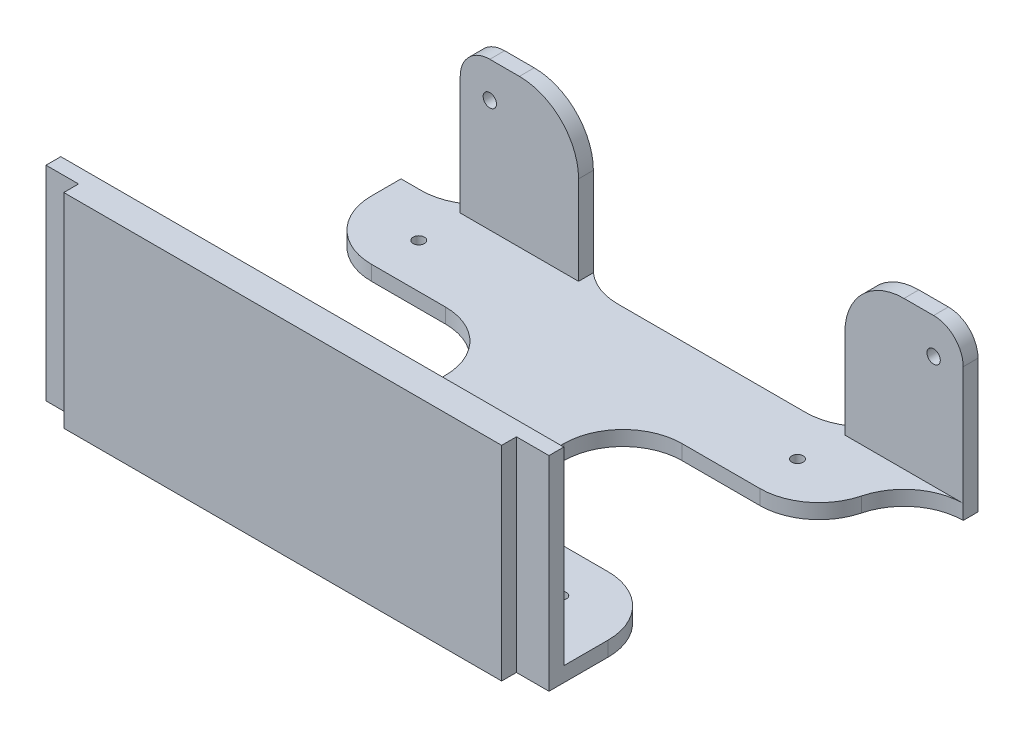
from build123d import *

# Parameters (mm, degrees)
SKETCH1_R           = 1.9
BOSS_EXTRUDE1_DEPTH = 5
SKETCH1_4_W         = 148
SKETCH1_4_H         = 5
BOSS_EXTRUDE3_DEPTH = 69
SKETCH1_5_W         = 150
SKETCH1_5_H         = 5
SKETCH1_5_W_2       = 20
BOSS_EXTRUDE4_DEPTH = 55
SKETCH2_R           = 2.25
CUT_EXTRUDE1_DEPTH  = 60
FILLET1_R           = 20
FILLET2_R           = 10
SKETCH4_W           = 90
SKETCH4_H           = 5
CUT_EXTRUDE2_DEPTH  = 55
FILLET3_R           = 20


# Some blends are built 0.0001 mm under size
with BuildPart() as part:
    # Sketch1 → Boss-Extrude1 (new body)
    with BuildSketch(Plane(origin=(0, 0, 0), x_dir=(1, 0, 0), z_dir=(0, 1, 0))):
        Polygon((-85, -22.5), (-85, -57.5), (85, -57.5), (85, -22.5), (20, -22.5), (20, 27.5), (85, 27.5), (85, 57.5), (-65, 57.5), (-85, 57.5), (-85, 27.5), (-20, 27.5), (-20, -22.5), align=None)
        with Locations(Location((-64, -37.5, 0), (0, 0, 270))):
            Circle(SKETCH1_R, mode=Mode.SUBTRACT)
        with Locations(Location((64, -37.5, 0), (0, 0, 270))):
            Circle(SKETCH1_R, mode=Mode.SUBTRACT)
        with Locations(Location((-64, 42.5, 0), (0, 0, 270))):
            Circle(SKETCH1_R, mode=Mode.SUBTRACT)
        with Locations(Location((64, 42.5, 0), (0, 0, 270))):
            Circle(SKETCH1_R, mode=Mode.SUBTRACT)
    extrude(amount=BOSS_EXTRUDE1_DEPTH)

    # Sketch1<4> → Boss-Extrude3 (add)
    with BuildSketch(Plane(origin=(0, 0, 0), x_dir=(1, 0, 0), z_dir=(0, 1, 0))):
        with Locations((0, -65)):
            Rectangle(SKETCH1_4_W, SKETCH1_4_H)
        Polygon((85, -57.5), (-85, -57.5), (-85, -62.5), (-74, -62.5), (74, -62.5), (85, -62.5), align=None)
    extrude(amount=BOSS_EXTRUDE3_DEPTH)

    # Sketch1<5> → Boss-Extrude4 (add)
    with BuildSketch(Plane(origin=(0, 0, 0), x_dir=(1, 0, 0), z_dir=(0, 1, 0))):
        with Locations((10, 60)):
            Rectangle(SKETCH1_5_W, SKETCH1_5_H)
        with Locations((95, 60)):
            Rectangle(SKETCH1_5_W_2, SKETCH1_5_H)
    extrude(amount=BOSS_EXTRUDE4_DEPTH)

    # Sketch2 → Cut-Extrude1 (cut)
    with BuildSketch(Plane(origin=(0, 0, -62.5), x_dir=(-1, 0, 0), z_dir=(0, 0, -1))):
        with Locations((-95, 43)):
            Circle(SKETCH2_R)
        with Locations((55, 43)):
            Circle(SKETCH2_R)
    extrude(amount=-CUT_EXTRUDE1_DEPTH, mode=Mode.SUBTRACT)

    # Fillet1
    fillet1_edges = [part.edges().sort_by_distance(p)[0] for p in [
        (85, 2.5, -57.5),
    ]]
    fillet(fillet1_edges, radius=FILLET1_R - 0.0001)  # a hair under: the kernel refuses the full size

    # Fillet2
    fillet2_edges = [part.edges().sort_by_distance(p)[0] for p in [
        (-65, 55, -60),
        (105, 55, -60),
    ]]
    fillet(fillet2_edges, radius=FILLET2_R)

    # Sketch4 → Cut-Extrude2 (cut)
    with BuildSketch(Plane(origin=(0, 55, 0), x_dir=(1, 0, 0), z_dir=(0, 1, 0))):
        with Locations((20, 60)):
            Rectangle(SKETCH4_W, SKETCH4_H)
    extrude(amount=-CUT_EXTRUDE2_DEPTH, mode=Mode.SUBTRACT)

    # Fillet3
    # the kernel refuses this fillet: 20 mm, written as the material it adds along each edge
    with BuildSketch(Plane(origin=(65, 5, -57.5), x_dir=(-1, 0, 0), z_dir=(0, -1, 0))) as fillet3_piece_1:
        with BuildLine():
            CenterArc((13.228756555, 20), FILLET3_R, 228.590377891, 41.409622109)
            Line((0, 5), (0, 0))
            Line((0, 0), (13.228756555, 0))
        make_face()
    extrude(amount=5)
    with BuildSketch(Plane(origin=(-25, 5, -57.5), x_dir=(0, 0, -1), z_dir=(0, -1, 0)), Plane(origin=(-65, 0, -57.5), x_dir=(0, 0, -1), z_dir=(0, 1, 0))) as fillet3_piece_2:
        with BuildLine():
            CenterArc((20, 13.228756555), FILLET3_R, 180, 41.409622109)
            Line((0, 13.228756555), (0, 0))
            Line((0, 0), (5, 0))
        make_face()
    extrude(amount=5)
    with BuildSketch(Plane(origin=(-20, 0, 22.5), x_dir=(-1, 0, 0), z_dir=(0, 1, 0)), Plane(origin=(-20, 0, -27.5), x_dir=(0, 0, 1), z_dir=(0, 1, 0)), Plane(origin=(20, 0, 22.5), x_dir=(0, 0, -1), z_dir=(0, 1, 0)), Plane(origin=(20, 0, -27.5), x_dir=(1, 0, 0), z_dir=(0, 1, 0))) as fillet3_piece_3:
        with BuildLine():
            CenterArc((FILLET3_R, -FILLET3_R), FILLET3_R, 90, 90)
            Line((0, -FILLET3_R), (0, 0))
            Line((0, 0), (FILLET3_R, 0))
        make_face()
    extrude(amount=5)
    # the kernel refuses this fillet: 20 mm, written as the material it takes off along each edge
    with BuildSketch(Plane(origin=(-25, 55, -7.5), x_dir=(0, -1, 0), z_dir=(0, 0, -1)), Plane(origin=(65, 55, -112.5), x_dir=(0, -1, 0), z_dir=(0, 0, 1))) as fillet3_2_piece_1:
        with BuildLine():
            CenterArc((FILLET3_R, FILLET3_R), FILLET3_R, 180, 90)
            Line((0, FILLET3_R), (0, 0))
            Line((0, 0), (FILLET3_R, 0))
        make_face()
    extrude(amount=105, mode=Mode.SUBTRACT)
    with BuildSketch(Plane(origin=(85, -46.824640006, -27.5), x_dir=(0.04230002714791386, 0, -0.999104953297343), z_dir=(0, 1, 0))) as fillet3_2_piece_2:
        with BuildLine():
            CenterArc((19.189825649, 19.559092449), FILLET3_R, 182.42433637, 75.522598767)
            Line((-0.792273417, 18.713091906), (-2.790483324, 18.628491852))
            Line((-2.790483324, 18.628491852), (-1.998209907, -0.084600054))
            Line((-1.998209907, -0.084600054), (0.084600054, -1.998209907))
            ThreePointArc((0.084600054, -1.998209907), (10.075749498, -1.575205405), (14.595840223, -1.955909245))
            Line((14.595840223, -1.955909245), (15.013475262, 0))
        make_face()
    extrude(amount=98.649280012, mode=Mode.SUBTRACT)
    with BuildSketch(Plane(origin=(-85, -50, -27.5), x_dir=(0, 0, -1), z_dir=(0, 1, 0)), Plane(origin=(-85, -50, 22.5), x_dir=(1, 0, 0), z_dir=(0, 1, 0)), Plane(origin=(85, -50, 22.5), x_dir=(0, 0, 1), z_dir=(0, 1, 0))) as fillet3_2_piece_3:
        with BuildLine():
            CenterArc((FILLET3_R, -FILLET3_R), FILLET3_R, 90, 90)
            Line((0, -FILLET3_R), (0, 0))
            Line((0, 0), (FILLET3_R, 0))
        make_face()
    extrude(amount=105, mode=Mode.SUBTRACT)


solid = part.part
